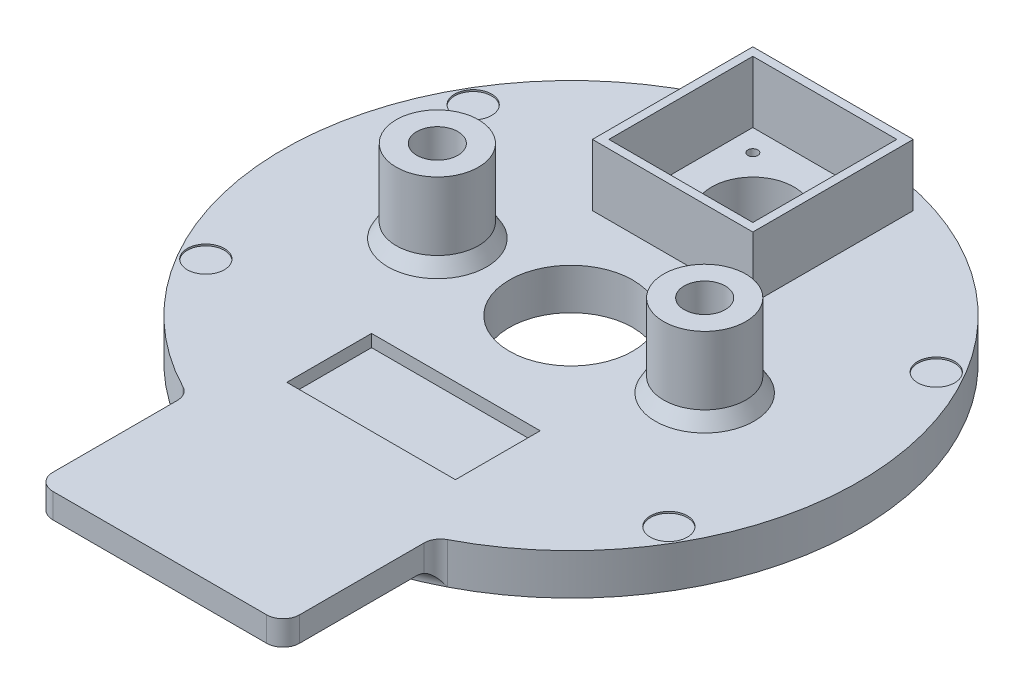
from build123d import *

# Parameters (mm, degrees)
SKETCH1_R           = 88.9
BOSS_EXTRUDE1_DEPTH = 12.7
SKETCH9_W           = 49.53
SKETCH9_H           = 49.53
SKETCH9_W_2         = 44.45
SKETCH9_H_2         = 44.45
BOSS_EXTRUDE2_DEPTH = 19.05
SKETCH10_R          = 5.715
CUT_EXTRUDE7_DEPTH  = 0.508
SKETCH14_R          = 19.05
CUT_EXTRUDE11_DEPTH = 12.7
SKETCH15_R          = 12.7
SKETCH15_R_2        = 6.35
BOSS_EXTRUDE3_DEPTH = 25.4
CUT_EXTRUDE12_START = -12.7
SKETCH16_R          = 6.35
CUT_EXTRUDE12_DEPTH = 12.7
SKETCH17_R          = 9.525
CUT_EXTRUDE13_DEPTH = 25.4
CHAMFER2_SIZE       = 2.54
CHAMFER2_SIZE2      = 4.399409051
SKETCH19_R          = 12.7
SKETCH19_R_2        = 1.524
CUT_EXTRUDE14_DEPTH = 12.7
CUT_EXTRUDE15_START = -5.08
SKETCH21_R          = 4.064
SKETCH21_R_2        = 5.715
CUT_EXTRUDE15_DEPTH = 5.08
SKETCH22_W          = 52.07
SKETCH22_H          = 26.162
CUT_EXTRUDE17_DEPTH = 3.81
BOSS_EXTRUDE5_START = -7.62
BOSS_EXTRUDE5_DEPTH = 7.62
FILLET2_R           = 5.08


with BuildPart() as part:
    # Sketch1 → Boss-Extrude1 (new body)
    with BuildSketch(Plane(origin=(0, 0, 0), x_dir=(1, 0, 0), z_dir=(0, 1, 0))):
        with Locations(Location((0, 0, 0), (0, 0, 270))):
            Circle(SKETCH1_R)
    extrude(amount=BOSS_EXTRUDE1_DEPTH)

    # Sketch9 → Boss-Extrude2 (add)
    with BuildSketch(Plane(origin=(0, 12.7, 0), x_dir=(1, 0, 0), z_dir=(0, 1, 0))):
        with Locations((0, 56.134)):
            Rectangle(SKETCH9_W, SKETCH9_H)
        with Locations((0, 56.134)):
            Rectangle(SKETCH9_W_2, SKETCH9_H_2, mode=Mode.SUBTRACT)
    extrude(amount=BOSS_EXTRUDE2_DEPTH)

    # Sketch10 → Cut-Extrude7 (cut)
    with BuildSketch(Plane(origin=(0, 12.7, 0), x_dir=(1, 0, 0), z_dir=(0, 1, 0))):
        with Locations(Location((-71.490397082, -41.275, 0), (0, 0, 270))):
            Circle(SKETCH10_R)
        with Locations(Location((-71.490397082, 41.275, 0), (0, 0, 270))):
            Circle(SKETCH10_R)
        with Locations(Location((71.490397082, 41.275, 0), (0, 0, 270))):
            Circle(SKETCH10_R)
        with Locations(Location((71.490397082, -41.275, 0), (0, 0, 270))):
            Circle(SKETCH10_R)
    extrude(amount=-CUT_EXTRUDE7_DEPTH, mode=Mode.SUBTRACT)

    # Sketch14 → Cut-Extrude11 (cut)
    with BuildSketch(Plane.XZ):
        with Locations(Location((0, 0, 0), (0, 0, 270))):
            Circle(SKETCH14_R)
    extrude(amount=-CUT_EXTRUDE11_DEPTH, mode=Mode.SUBTRACT)

    # Sketch15 → Boss-Extrude3 (add)
    # profile 1 of 2: a face of its own
    with BuildSketch(Plane(origin=(0, 12.7, 0), x_dir=(1, 0, 0), z_dir=(0, 1, 0))):
        with Locations(Location((-41.275, 0, 0), (0, 0, 270))):
            Circle(SKETCH15_R)
        with Locations(Location((-41.275, 0, 0), (0, 0, 270))):
            Circle(SKETCH15_R_2, mode=Mode.SUBTRACT)
    # profile 2 of 2: a face of its own
    with BuildSketch(Plane(origin=(0, 12.7, 0), x_dir=(1, 0, 0), z_dir=(0, 1, 0))):
        with Locations(Location((41.275, 0, 0), (0, 0, 270))):
            Circle(SKETCH15_R)
        with Locations(Location((41.275, 0, 0), (0, 0, 270))):
            Circle(SKETCH15_R_2, mode=Mode.SUBTRACT)
    extrude(amount=BOSS_EXTRUDE3_DEPTH)

    # Sketch16 → Cut-Extrude12 (cut)
    with BuildSketch(Plane(origin=(0, 12.7, 0), x_dir=(1, 0, 0), z_dir=(0, 1, 0)).offset(CUT_EXTRUDE12_START)):
        with Locations(Location((41.275, 0, 0), (0, 0, 270))):
            Circle(SKETCH16_R)
        with Locations(Location((-41.275, 0, 0), (0, 0, 270))):
            Circle(SKETCH16_R)
    extrude(amount=CUT_EXTRUDE12_DEPTH, mode=Mode.SUBTRACT)

    # Sketch17 → Cut-Extrude13 (cut)
    with BuildSketch(Plane.XZ):
        with Locations(Location((41.275, 0, 0), (0, 0, 270))):
            Circle(SKETCH17_R)
        with Locations(Location((-41.275, 0, 0), (0, 0, 270))):
            Circle(SKETCH17_R)
    extrude(amount=-CUT_EXTRUDE13_DEPTH, mode=Mode.SUBTRACT)

    # Chamfer2
    chamfer2_edges = [part.edges().sort_by_distance(p)[0] for p in [
        (-41.275, 12.7, -12.7),
        (41.275, 12.7, -12.7),
    ]]
    chamfer2_side = [part.faces().sort_by_distance(p)[0] for p in [
        (0, 12.7, -86.385528286),
    ]]
    chamfer(chamfer2_edges, length=CHAMFER2_SIZE, length2=CHAMFER2_SIZE2, reference=chamfer2_side[0])

    # Sketch19 → Cut-Extrude14 (cut)
    with BuildSketch(Plane(origin=(0, 12.7, 0), x_dir=(1, 0, 0), z_dir=(0, 1, 0))):
        with Locations(Location((0, 56.134, 0), (0, 0, 270))):
            Circle(SKETCH19_R)
        with Locations(Location((15.494, 71.628, 0), (0, 0, 270))):
            Circle(SKETCH19_R_2)
        with Locations(Location((15.494, 40.64, 0), (0, 0, 270))):
            Circle(SKETCH19_R_2)
        with Locations(Location((-15.494, 40.64, 0), (0, 0, 270))):
            Circle(SKETCH19_R_2)
        with Locations(Location((-15.494, 71.628, 0), (0, 0, 270))):
            Circle(SKETCH19_R_2)
    extrude(amount=-CUT_EXTRUDE14_DEPTH, mode=Mode.SUBTRACT)

    # Sketch21 → Cut-Extrude15 (cut)
    with BuildSketch(Plane.XZ.offset(CUT_EXTRUDE15_START)):
        with Locations(Location((-15.494, -71.628, 0), (0, 0, 270))):
            Circle(SKETCH21_R)
        with Locations(Location((15.494, -71.628, 0), (0, 0, 270))):
            Circle(SKETCH21_R)
        with Locations(Location((15.494, -40.64, 0), (0, 0, 270))):
            Circle(SKETCH21_R)
        with Locations(Location((-15.494, -40.64, 0), (0, 0, 270))):
            Circle(SKETCH21_R)
        with Locations(Location((-71.490397082, 41.275, 0), (0, 0, 90))):
            Circle(SKETCH21_R_2)
        with Locations(Location((71.490397082, 41.275, 0), (0, 0, 90))):
            Circle(SKETCH21_R_2)
        with Locations(Location((71.490397082, -41.275, 0), (0, 0, 90))):
            Circle(SKETCH21_R_2)
        with Locations(Location((-71.490397082, -41.275, 0), (0, 0, 90))):
            Circle(SKETCH21_R_2)
    extrude(amount=CUT_EXTRUDE15_DEPTH, mode=Mode.SUBTRACT)

    # Sketch22 → Cut-Extrude17 (cut)
    with BuildSketch(Plane(origin=(0, 12.7, 0), x_dir=(1, 0, 0), z_dir=(0, 1, 0))):
        with Locations((0, -48.641)):
            Rectangle(SKETCH22_W, SKETCH22_H)
    extrude(amount=-CUT_EXTRUDE17_DEPTH, mode=Mode.SUBTRACT)

    # Sketch23 → Boss-Extrude5 (add)
    with BuildSketch(Plane(origin=(0, 12.7, 0), x_dir=(1, 0, 0), z_dir=(0, 1, 0)).offset(BOSS_EXTRUDE5_START)):
        with BuildLine():
            Line((-38.1, -80.321852568), (-38.1, -127))
            Line((-38.1, -127), (38.1, -127))
            Line((38.1, -127), (38.1, -80.321852568))
            ThreePointArc((38.1, -80.321852568), (0, -88.9), (-38.1, -80.321852568))
        make_face()
    extrude(amount=BOSS_EXTRUDE5_DEPTH)

    # Fillet2
    fillet2_edges = [part.edges().sort_by_distance(p)[0] for p in [
        (-19.526870034, 5.08, 86.728953335),
        (-38.1, 8.89, 80.321852568),
        (38.1, 8.89, 80.321852568),
        (38.1, 8.89, 127),
        (-38.1, 8.89, 127),
    ]]
    fillet(fillet2_edges, radius=FILLET2_R - 0.0001)  # a hair under: the kernel refuses the full size


solid = part.part
